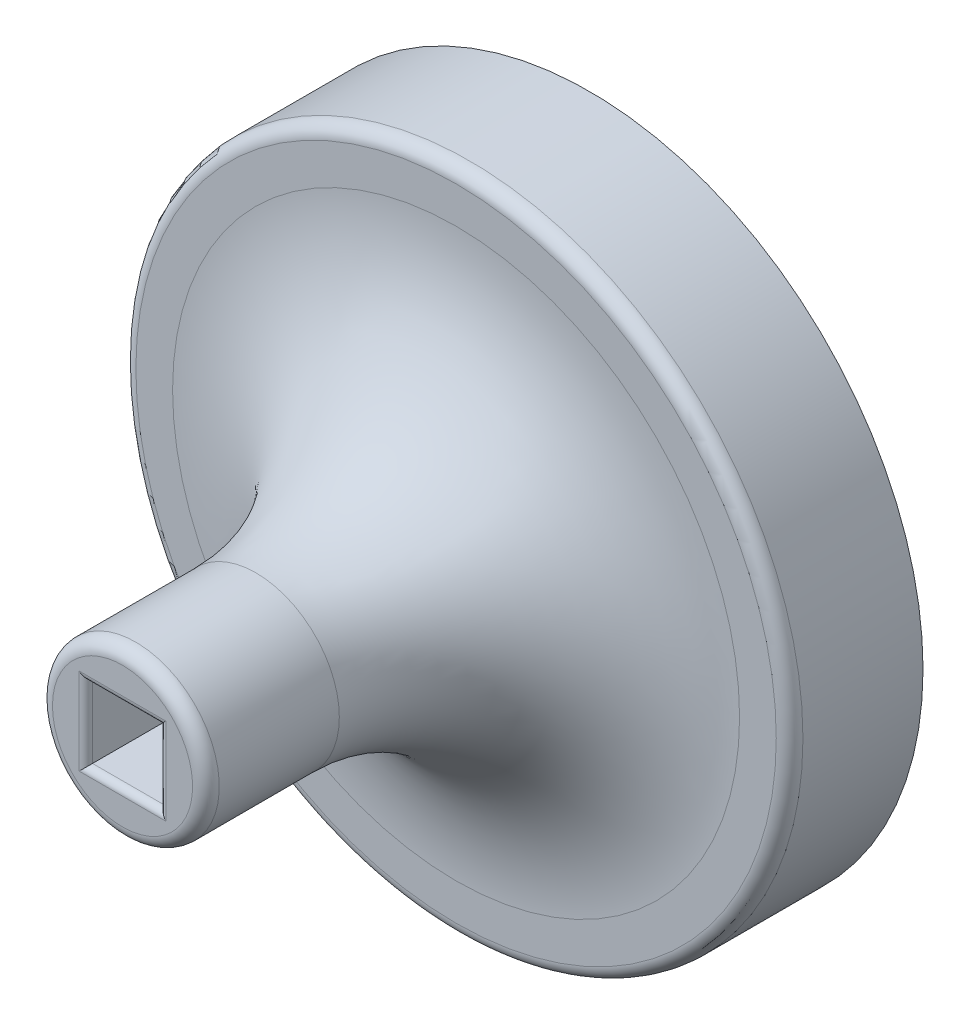
from build123d import *

# Parameters (mm, degrees)
ESQUISSE1_R             = 25
BOSS_EXTRU_1_DEPTH      = 10
ESQUISSE2_R             = 6.25
BOSS_EXTRU_2_DEPTH      = 35
ESQUISSE3_W             = 5.5
ESQUISSE3_H             = 5.5
ENL_V_MAT_EXTRU_1_DEPTH = 40
CONG_1_R                = 15
CONG_2_R                = 1
CONG_4_R                = 0.5


with BuildPart() as part:
    # Esquisse1 → Boss.-Extru.1 (new body)
    with BuildSketch(Plane.XY):
        Circle(ESQUISSE1_R)
    extrude(amount=BOSS_EXTRU_1_DEPTH)

    # Esquisse2 → Boss.-Extru.2 (add)
    with BuildSketch(Plane(origin=(0, 0, 0), x_dir=(-1, 0, 0), z_dir=(0, 0, -1))):
        Circle(ESQUISSE2_R)
    extrude(amount=-BOSS_EXTRU_2_DEPTH)

    # Esquisse3 → Enlèv. mat.-Extru.1 (cut)
    with BuildSketch(Plane(origin=(0, 0, 0), x_dir=(-1, 0, 0), z_dir=(0, 0, -1))):
        Rectangle(ESQUISSE3_W, ESQUISSE3_H)
    extrude(amount=-ENL_V_MAT_EXTRU_1_DEPTH, mode=Mode.SUBTRACT)

    # Congé1
    cong_1_edges = [part.edges().sort_by_distance(p)[0] for p in [
        (6.25, 0, 10),
    ]]
    fillet(cong_1_edges, radius=CONG_1_R)

    # Congé2
    cong_2_edges = [part.edges().sort_by_distance(p)[0] for p in [
        (-25, 0, 10),
        (6.25, 0, 35),
    ]]
    fillet(cong_2_edges, radius=CONG_2_R)

    # Congé4
    cong_4_edges = [part.edges().sort_by_distance(p)[0] for p in [
        (-2.75, 0, 35),
        (0, 2.75, 35),
        (2.75, 0, 35),
        (0, -2.75, 35),
    ]]
    fillet(cong_4_edges, radius=CONG_4_R)


solid = part.part
